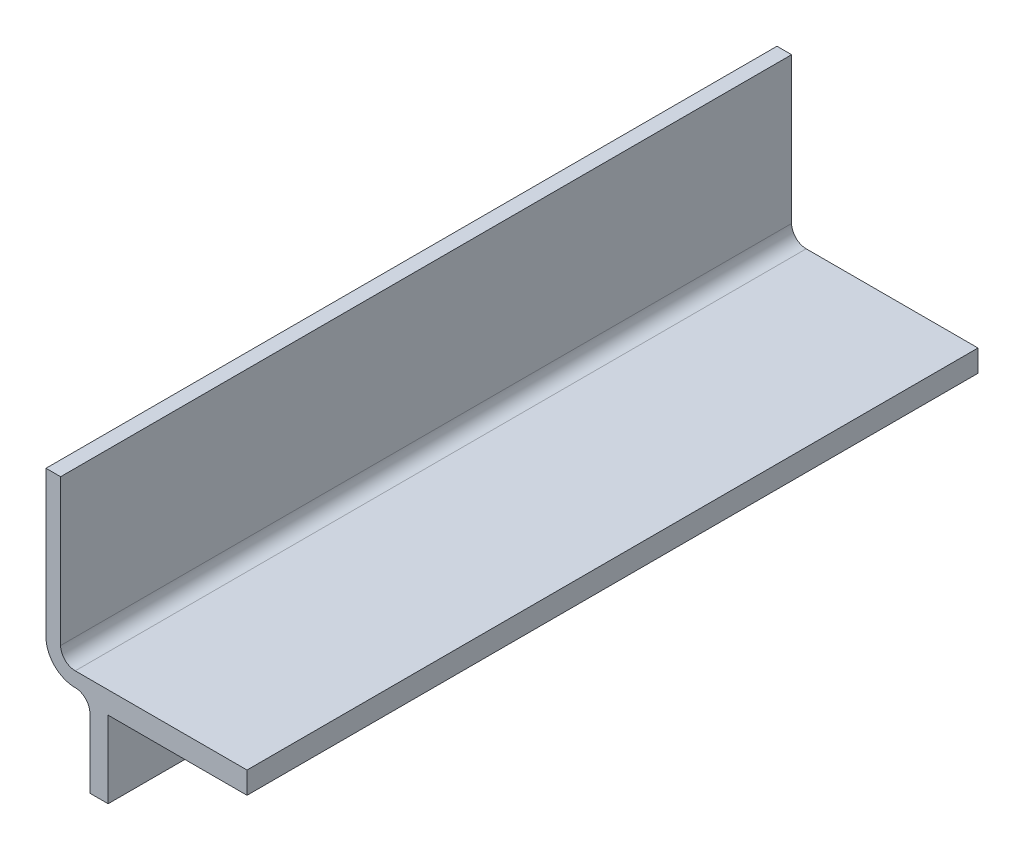
from build123d import *

# Parameters (mm, degrees)
ESTRUSIONE_ESTRUSIONE1_DEPTH           = 100
RACCORDO1_R                            = 2
RACCORDO2_R                            = 4
FORO_SVASATO_PER_VITE_M4_1_D           = 4.5
FORO_SVASATO_PER_VITE_M4_1_DEPTH       = 188
FORO_SVASATO_PER_VITE_M4_1_CSINK_D     = 9.4
FORO_SVASATO_PER_VITE_M4_1_CSINK_ANGLE = 90
FORO_SVASATO_PER_VITE_M4_1_TIP         = 1.351936393


with BuildPart() as part:
    # Schizzo1 → Estrusione-Estrusione1 (new body)
    with BuildSketch(Plane.XY):
        Polygon((0, 0), (-2.5, 0), (-2.5, 11.5), (-8.5, 11.5), (-8.5, 35.5), (-6.5, 35.5), (-6.5, 13.5), (19, 13.5), (19, 10.5), (0, 10.5), align=None)
    extrude(amount=ESTRUSIONE_ESTRUSIONE1_DEPTH)

    # Raccordo1
    raccordo1_edges = [part.edges().sort_by_distance(p)[0] for p in [
        (-2.5, 11.5, 50),
        (-6.5, 13.5, 50),
    ]]
    fillet(raccordo1_edges, radius=RACCORDO1_R)

    # Raccordo2
    raccordo2_edges = [part.edges().sort_by_distance(p)[0] for p in [
        (-8.5, 11.5, 50),
    ]]
    fillet(raccordo2_edges, radius=RACCORDO2_R - 0.0001)  # a hair under: the kernel refuses the full size

    # Foro svasato per Vite M4-1
    with Locations(Plane.ZY.offset(2.5)):
        with Locations((85, 4.5), (15, 4.5)):
            CounterSinkHole(FORO_SVASATO_PER_VITE_M4_1_D / 2, FORO_SVASATO_PER_VITE_M4_1_CSINK_D / 2, depth=FORO_SVASATO_PER_VITE_M4_1_DEPTH, counter_sink_angle=FORO_SVASATO_PER_VITE_M4_1_CSINK_ANGLE)
            with Locations((0, 0, -(FORO_SVASATO_PER_VITE_M4_1_DEPTH + FORO_SVASATO_PER_VITE_M4_1_TIP / 2))):  # 118° drill point
                Cone(0, FORO_SVASATO_PER_VITE_M4_1_D / 2, FORO_SVASATO_PER_VITE_M4_1_TIP, mode=Mode.SUBTRACT)


solid = part.part
